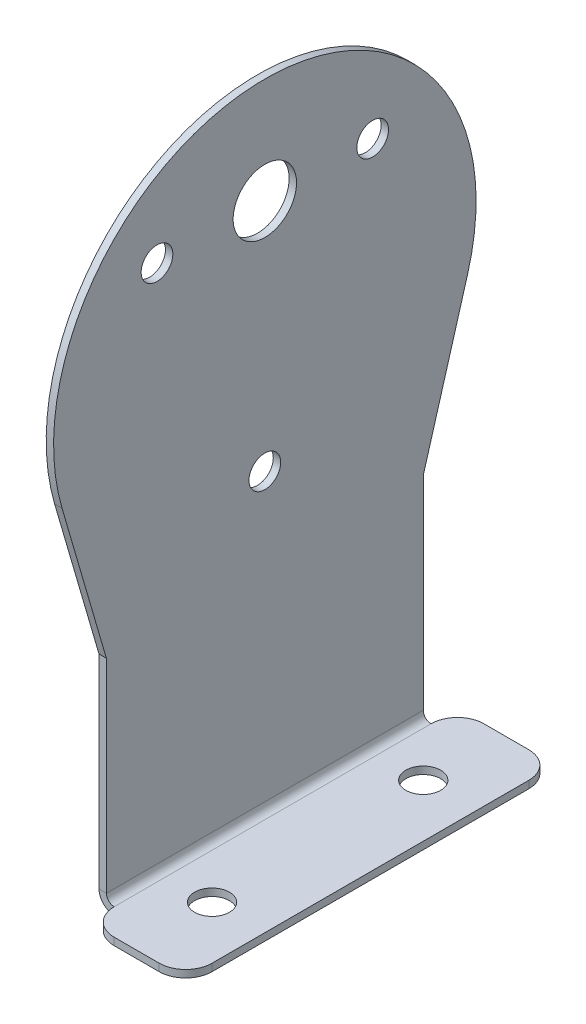
from build123d import *

# Parameters (mm, degrees)
BASE_FLANGE1_DEPTH           = 0.7
SKETCH4_R                    = 1.5
SKETCH4_R_2                  = 3
CUT_EXTRUDE1_DEPTH           = 45.726837581
EDGE_FLANGE1_STRIP_W         = 4.2732
EDGE_FLANGE1_STRIP_H         = 0.7
EDGE_FLANGE1_STRIP_CUT_DEPTH = 30
EDGE_FLANGE1_DEPTH           = 30
SKETCH11_W                   = 9.2634
SKETCH11_H                   = 2.5
TAB1_DEPTH                   = 0.7
SKETCH10_R                   = 1.65
CUT_EXTRUDE2_DEPTH           = 0.7
BREAK_CORNER1_START          = -40.7
BREAK_CORNER1_DEPTH          = 0.7


# Read off the part's stored shape, not the designer's step: Break-Corner1
# Sheet-metal steps are written as plain solids
with BuildPart() as part:
    # Sketch1 → Base-Flange1 (new body)
    with BuildSketch(Plane(origin=(0, 0, 0), x_dir=(0, 0, -1), z_dir=(1, 0, 0))):
        with BuildLine():
            Line((-19.2, -5.6), (-15, -20))
            Line((-15, -20), (-15, -40))
            Line((-15, -40), (15, -40))
            Line((15, -40), (15, -20))
            Line((15, -20), (19.2, -5.6))
            ThreePointArc((19.2, -5.6), (0, 20), (-19.2, -5.6))
        make_face()
    extrude(amount=-BASE_FLANGE1_DEPTH)

    # Sketch4 → Cut-Extrude1 (cut, through all)
    with BuildSketch(Plane(origin=(0, 0, 0), x_dir=(0, 0, -1), z_dir=(1, 0, 0))):
        with Locations((-10.2108, 10)):
            Circle(SKETCH4_R)
        with Locations((10.2108, 10)):
            Circle(SKETCH4_R)
        with Locations((0, 10)):
            Circle(SKETCH4_R_2)
        with Locations((0, -12.1742)):
            Circle(SKETCH4_R)
    extrude(amount=-CUT_EXTRUDE1_DEPTH, mode=Mode.SUBTRACT)

    # Edge-Flange1 strip (across the edge) → Edge-Flange1 strip cut (cut)
    with BuildSketch(Plane(origin=(0, -40, 15), x_dir=(0, 1, 0), z_dir=(0, 0, -1))):
        with Locations((-1.4, -0.35)):
            Rectangle(EDGE_FLANGE1_STRIP_W, EDGE_FLANGE1_STRIP_H)
    extrude(amount=EDGE_FLANGE1_STRIP_CUT_DEPTH, mode=Mode.SUBTRACT)

    # Edge-Flange1 section (across the edge) → Edge-Flange1 (add)
    with BuildSketch(Plane(origin=(0, -40, 15), x_dir=(0, 1, 0), z_dir=(0, 0, -1))):
        with BuildLine():
            Line((-0.7, 0.7366), (-0.7, 10))
            Line((-0.7, 10), (0, 10))
            Line((0, 10), (0, 0.7366))
            ThreePointArc((0, 0.7366), (0.215745145, 0.215745145), (0.7366, 0))
            Line((0.7366, 0), (0.7366, -0.7))
            ThreePointArc((0.7366, -0.7), (-0.279229602, -0.279229602), (-0.7, 0.7366))
        make_face()
    extrude(amount=EDGE_FLANGE1_DEPTH)

    # Sketch11 → Tab1 (add)
    with BuildSketch(Plane(origin=(0, -40, 0), x_dir=(1, 0, 0), z_dir=(0, 1, 0))):
        with Locations((5.3683, -16.25)):
            Rectangle(SKETCH11_W, SKETCH11_H)
    tab1 = extrude(amount=-TAB1_DEPTH)

    # Mirror1: Tab1 across plane
    add(tab1.mirror(Plane.XY))

    # Sketch10 → Cut-Extrude2 (cut)
    with BuildSketch(Plane(origin=(0, -40, 0), x_dir=(1, 0, 0), z_dir=(0, 1, 0))):
        with Locations(Location((5, 10, 0), (0, 0, 180))):
            Circle(SKETCH10_R)
        with Locations((5, -10)):
            Circle(SKETCH10_R)
    extrude(amount=-CUT_EXTRUDE2_DEPTH, mode=Mode.SUBTRACT)

    # Break-Corner1 outline → Break-Corner1 (cut)
    with BuildSketch(Plane(origin=(0, 0, 0), x_dir=(1, 0, 0), z_dir=(0, 1, 0)).offset(BREAK_CORNER1_START)):
        with BuildLine():
            Line((10, -17.5), (10, -15))
            ThreePointArc((10, -15), (9.267766953, -16.767766953), (7.5, -17.5))
            Line((7.5, -17.5), (10, -17.5))
        make_face()
        with BuildLine():
            ThreePointArc((0.7366, 15), (1.468833047, 16.767766953), (3.2366, 17.5))
            Line((3.2366, 17.5), (0.7366, 17.5))
            Line((0.7366, 17.5), (0.7366, 15))
        make_face()
        with BuildLine():
            ThreePointArc((7.5, 17.5), (9.267766953, 16.767766953), (10, 15))
            Line((10, 15), (10, 17.5))
            Line((10, 17.5), (7.5, 17.5))
        make_face()
        with BuildLine():
            Line((0.7366, -17.5), (3.2366, -17.5))
            ThreePointArc((3.2366, -17.5), (1.468833047, -16.767766953), (0.7366, -15))
            Line((0.7366, -15), (0.7366, -17.5))
        make_face()
    extrude(amount=BREAK_CORNER1_DEPTH, mode=Mode.SUBTRACT)


solid = part.part
